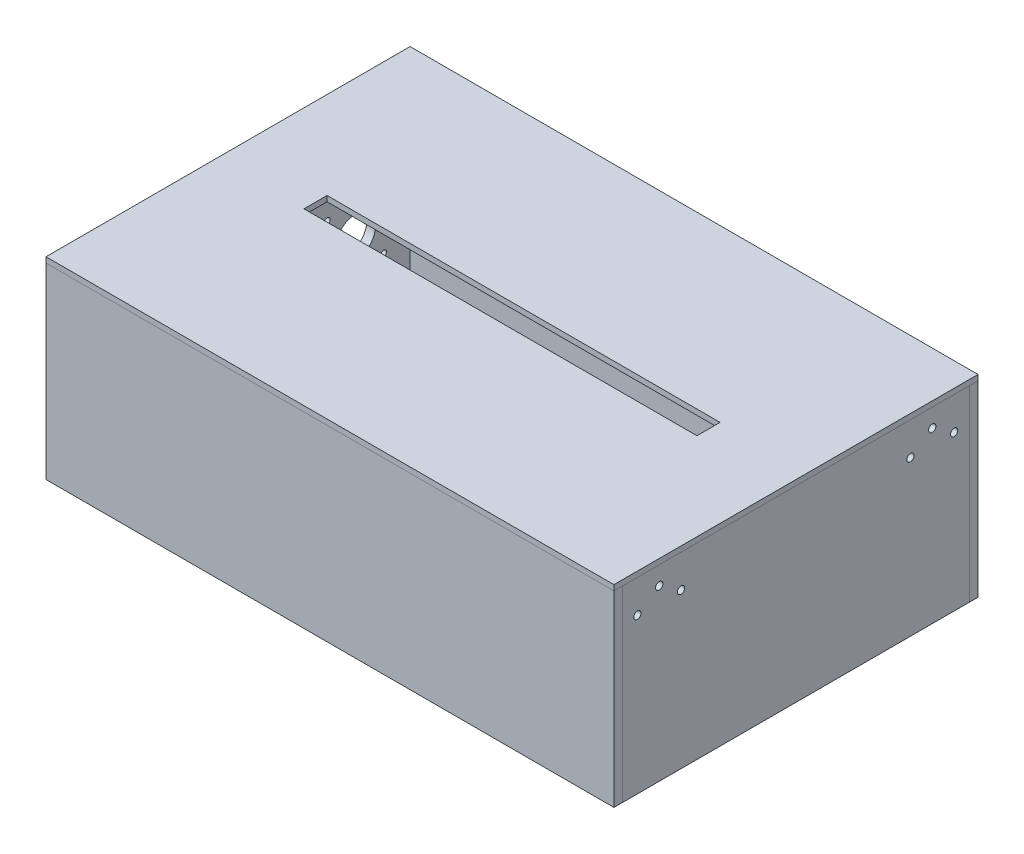
from build123d import *

# Parameters (mm, degrees)
SKETCH1_W                    = 312
SKETCH1_H                    = 200
BOSS_EXTRUDE1_DEPTH          = 4.75
SKETCH2_W                    = 215.9
SKETCH2_H                    = 12.7
CUT_EXTRUDE6_DEPTH           = 10
SKETCH3_R                    = 1.55
SKETCH3_R_2                  = 1.905
CUT_EXTRUDE2_DEPTH           = 3.81
CONVERT_SOLID1_START         = 3
CONVERT_SOLID1_OUTLINE_W     = 312
CONVERT_SOLID1_OUTLINE_H     = 200
CONVERT_SOLID1_OUTLINE_R     = 1.55
CONVERT_SOLID1_OUTLINE_R_2   = 1.905
CONVERT_SOLID1_OUTLINE_W_2   = 215.9
CONVERT_SOLID1_OUTLINE_H_2   = 12.7
CONVERT_SOLID1_DEPTH         = 1.75
CONVERT_SOLID1_START_2       = 0.94
CONVERT_SOLID1_2_OUTLINE_R   = 1.55
CONVERT_SOLID1_2_OUTLINE_R_2 = 1.905
CONVERT_SOLID1_2_DEPTH       = 2.06
SKETCH25_W                   = 312
SKETCH25_H                   = 103
BOSS_EXTRUDE3_DEPTH          = 4.75
SKETCH26_W                   = 312
SKETCH26_H                   = 103
BOSS_EXTRUDE4_DEPTH          = 4.75
SKETCH27_W                   = 190.5
SKETCH27_H                   = 103
BOSS_EXTRUDE5_DEPTH          = 4.75
SKETCH28_W                   = 190.5
SKETCH28_H                   = 103
BOSS_EXTRUDE6_DEPTH          = 4.75
SKETCH30_R                   = 11
SKETCH30_R_2                 = 1.6
SKETCH30_R_3                 = 4.168475053
CUT_EXTRUDE7_DEPTH           = 10
SKETCH32_R                   = 2
CUT_EXTRUDE8_DEPTH           = 392


# Read off the part's stored shape, not the designer's step: Convert-Solid1
with BuildPart() as part:
    # Sketch1 → Boss-Extrude1 (new body)
    with BuildSketch(Plane(origin=(0, 0, 0), x_dir=(1, 0, 0), z_dir=(0, 1, 0))):
        with Locations((156, 100)):
            Rectangle(SKETCH1_W, SKETCH1_H)
    extrude(amount=BOSS_EXTRUDE1_DEPTH)

    # Sketch2 → Cut-Extrude6 (cut)
    with BuildSketch(Plane(origin=(0, 4.75, 0), x_dir=(1, 0, 0), z_dir=(0, 1, 0))):
        with Locations((156, 100)):
            Rectangle(SKETCH2_W, SKETCH2_H)
    extrude(amount=-CUT_EXTRUDE6_DEPTH, mode=Mode.SUBTRACT)

    # Sketch3 → Cut-Extrude2 (cut)
    with BuildSketch(Plane(origin=(0, 4.75, 0), x_dir=(1, 0, 0), z_dir=(0, 1, 0))):
        with Locations(Location((43.605, 65, 0), (0, 0, 270))):
            Circle(SKETCH3_R)
        with Locations(Location((43.605, 135, 0), (0, 0, 270))):
            Circle(SKETCH3_R_2)
        with Locations(Location((268.395, 135, 0), (0, 0, 270))):
            Circle(SKETCH3_R_2)
        with Locations(Location((268.395, 65, 0), (0, 0, 270))):
            Circle(SKETCH3_R)
    extrude(amount=-CUT_EXTRUDE2_DEPTH, mode=Mode.SUBTRACT)

    # Convert-Solid1 outline → Convert-Solid1 (cut)
    with BuildSketch(Plane(origin=(0, 0, 0), x_dir=(1, 0, 0), z_dir=(0, 1, 0)).offset(CONVERT_SOLID1_START)):
        with Locations((156, 100)):
            Rectangle(CONVERT_SOLID1_OUTLINE_W, CONVERT_SOLID1_OUTLINE_H)
        with Locations((43.605, 65)):
            Circle(CONVERT_SOLID1_OUTLINE_R, mode=Mode.SUBTRACT)
        with Locations((268.395, 65)):
            Circle(CONVERT_SOLID1_OUTLINE_R, mode=Mode.SUBTRACT)
        with Locations((43.605, 135)):
            Circle(CONVERT_SOLID1_OUTLINE_R_2, mode=Mode.SUBTRACT)
        with Locations((156, 100)):
            Rectangle(CONVERT_SOLID1_OUTLINE_W_2, CONVERT_SOLID1_OUTLINE_H_2, mode=Mode.SUBTRACT)
        with Locations((268.395, 135)):
            Circle(CONVERT_SOLID1_OUTLINE_R_2, mode=Mode.SUBTRACT)
    extrude(amount=CONVERT_SOLID1_DEPTH, mode=Mode.SUBTRACT)

    # Convert-Solid1 2 outline → Convert-Solid1 2 (add)
    with BuildSketch(Plane(origin=(0, 0, 0), x_dir=(1, 0, 0), z_dir=(0, 1, 0)).offset(CONVERT_SOLID1_START_2)):
        with Locations((43.605, 65)):
            Circle(CONVERT_SOLID1_2_OUTLINE_R)
        with Locations((43.605, 135)):
            Circle(CONVERT_SOLID1_2_OUTLINE_R_2)
        with Locations((268.395, 135)):
            Circle(CONVERT_SOLID1_2_OUTLINE_R_2)
        with Locations((268.395, 65)):
            Circle(CONVERT_SOLID1_2_OUTLINE_R)
    extrude(amount=CONVERT_SOLID1_2_DEPTH)


with BuildPart() as body_2:
    # Sketch25 → Boss-Extrude3 (new body)
    with BuildSketch(Plane.XY):
        with Locations((156, -51.5)):
            Rectangle(SKETCH25_W, SKETCH25_H)
    extrude(amount=-BOSS_EXTRUDE3_DEPTH)


with BuildPart() as body_3:
    # Sketch26 → Boss-Extrude4 (new body)
    with BuildSketch(Plane(origin=(0, 0, -200), x_dir=(-1, 0, 0), z_dir=(0, 0, -1))):
        with Locations((-156, -51.5)):
            Rectangle(SKETCH26_W, SKETCH26_H)
    extrude(amount=-BOSS_EXTRUDE4_DEPTH)


with BuildPart() as body_4:
    # Sketch27 → Boss-Extrude5 (new body)
    with BuildSketch(Plane.ZY):
        with Locations((-100, -51.5)):
            Rectangle(SKETCH27_W, SKETCH27_H)
    extrude(amount=-BOSS_EXTRUDE5_DEPTH)

    # Sketch30 → Cut-Extrude7 (cut)
    with BuildSketch(Plane.ZY):
        with Locations((-165.25, -68)):
            Circle(SKETCH30_R)
        with Locations((-149.75, -52.5)):
            Circle(SKETCH30_R_2)
        with Locations((-180.75, -52.5)):
            Circle(SKETCH30_R_2)
        with Locations((-126.187406099, -32.55692629)):
            Circle(SKETCH30_R_3)
        with Locations((-180.75, -83.5)):
            Circle(SKETCH30_R_2)
        with Locations((-149.75, -83.5)):
            Circle(SKETCH30_R_2)
    extrude(amount=-CUT_EXTRUDE7_DEPTH, mode=Mode.SUBTRACT)


with BuildPart() as body_5:
    # Sketch28 → Boss-Extrude6 (new body)
    with BuildSketch(Plane(origin=(312, 0, 0), x_dir=(0, 0, -1), z_dir=(1, 0, 0))):
        with Locations((100, -51.5)):
            Rectangle(SKETCH28_W, SKETCH28_H)
    extrude(amount=-BOSS_EXTRUDE6_DEPTH)


with BuildPart() as cut_extrude8_tool:
    # Sketch32 → Cut-Extrude8 (new body)
    with BuildSketch(Plane.ZY):
        with Locations(Location((-174.881920661, -10, 0), (0, 0, 180))):
            Circle(SKETCH32_R)
        with Locations(Location((-162.881920661, -18, 0), (0, 0, 180))):
            Circle(SKETCH32_R)
        with Locations(Location((-24.881920661, -10, 0), (0, 0, 180))):
            Circle(SKETCH32_R)
        with Locations(Location((-36.881920661, -18, 0), (0, 0, 180))):
            Circle(SKETCH32_R)
        with Locations(Location((-12.881920661, -18, 0), (0, 0, 180))):
            Circle(SKETCH32_R)
        with Locations(Location((-186.881920661, -18, 0), (0, 0, 180))):
            Circle(SKETCH32_R)
    extrude(amount=-CUT_EXTRUDE8_DEPTH)


with BuildPart() as body_4_1:
    add(body_4.part)

    # Cut-Extrude8: cut by cut_extrude8_tool
    add(cut_extrude8_tool.part, mode=Mode.SUBTRACT)


with BuildPart() as body_5_1:
    add(body_5.part)

    # Cut-Extrude8: cut by cut_extrude8_tool
    add(cut_extrude8_tool.part, mode=Mode.SUBTRACT)


solid = Compound([part.part, body_2.part, body_3.part, body_4_1.part, body_5_1.part])
